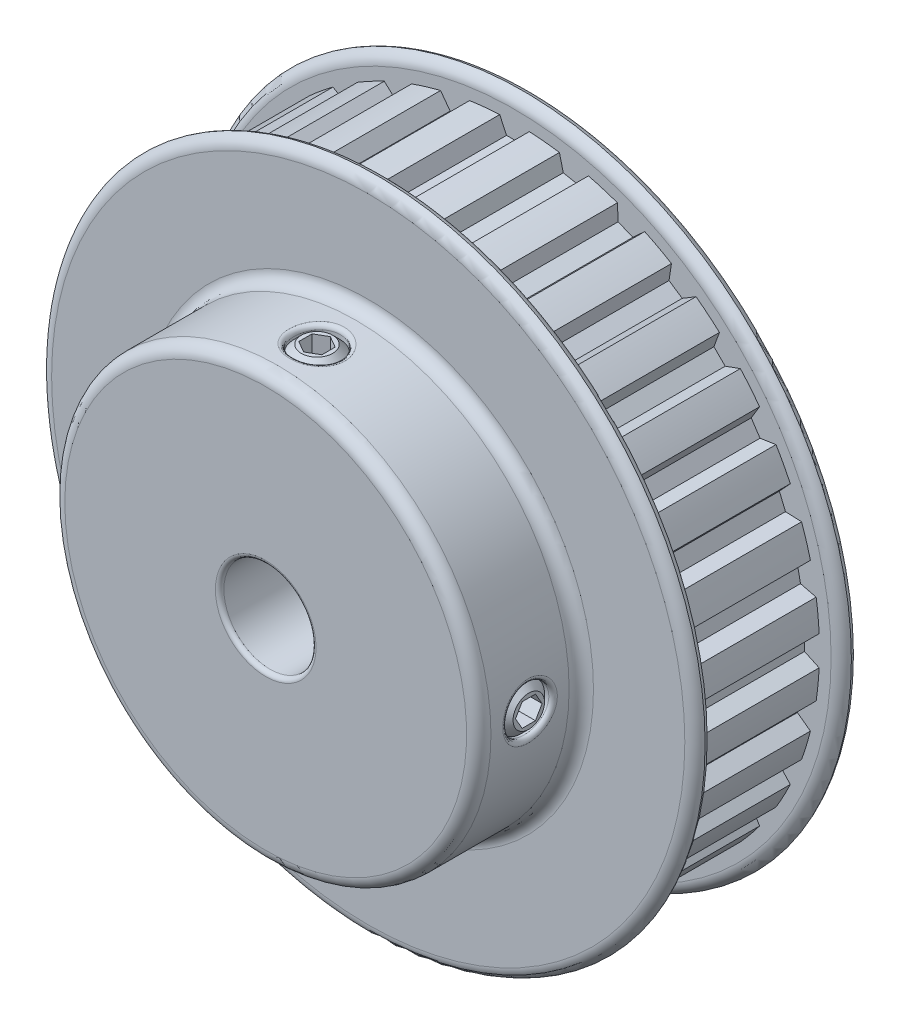
from build123d import *

# Parameters (mm, degrees)
CUT_EXTRUDE1_START = -10.05
CUT_EXTRUDE1_DEPTH = 11.2
CIRPATTERN1_COUNT  = 32
SKETCH4_R          = 2
CUT_EXTRUDE2_DEPTH = 42.927347877
CUT_EXTRUDE3_DEPTH = 1.5
CIRPATTERN2_COUNT  = 2
CIRPATTERN2_ANGLE  = 90
FILLET1_R          = 1.057142857
FILLET2_R          = 0.37


with BuildPart() as part:
    # Sketch7 → Revolve1 (revolve)
    with BuildSketch(Plane(origin=(0, 0, 0), x_dir=(0, 0, -1), z_dir=(1, 0, 0)), mode=Mode.PRIVATE) as revolve1_sk:
        with BuildLine():
            Line((-11.55, 4), (-11.55, 18.5))
            Line((-11.55, 18.5), (-2.65, 18.5))
            Line((-2.65, 18.5), (-2.65, 28.5))
            Line((-2.65, 28.5), (-1.9, 28.5))
            ThreePointArc((-1.9, 28.5), (-1.358015269, 28.119219543), (-1.15, 27.49035481))
            Line((-1.15, 27.49035481), (-1.15, 26.480709619))
            Line((-1.15, 26.480709619), (10.05, 26.480709619))
            Line((10.05, 26.480709619), (10.05, 27.49035481))
            ThreePointArc((10.05, 27.49035481), (10.258015269, 28.119219543), (10.8, 28.5))
            Line((10.8, 28.5), (11.55, 28.5))
            Line((11.55, 28.5), (11.55, 4))
            Line((11.55, 4), (-11.55, 4))
        make_face()
    revolve(revolve1_sk.sketch.rotate(Axis((0, 0, 11.55), (0, 0, -1)), 90), axis=Axis((0, 0, 11.55), (0, 0, -1)))

    # Sketch3 → Cut-Extrude1 (cut)
    with BuildSketch(Plane.XY.offset(CUT_EXTRUDE1_START)):
        with BuildLine():
            Line((-0.690489274, 25.179625), (0.690489274, 25.179625))
            Line((0.690489274, 25.179625), (1.2827, 26.449625))
            ThreePointArc((1.2827, 26.449625), (0, 26.480709619), (-1.2827, 26.449625))
            Line((-1.2827, 26.449625), (-0.690489274, 25.179625))
        make_face()
    cut_extrude1 = extrude(amount=CUT_EXTRUDE1_DEPTH, mode=Mode.SUBTRACT)

    # CirPattern1: Cut-Extrude1 ×32 about axis
    cirpattern1_axis = Axis((0, 0, 0), (0, 0, 1))
    for i in range(1, CIRPATTERN1_COUNT):
        add(cut_extrude1.rotate(cirpattern1_axis, i * 360 / CIRPATTERN1_COUNT), mode=Mode.SUBTRACT)

    # Sketch4 → Cut-Extrude2 (cut, through all)
    with BuildSketch(Plane(origin=(0, 0, 0), x_dir=(1, 0, 0), z_dir=(0, 1, 0))):
        with Locations(Location((0, -7.1, 0), (0, 0, 90))):
            Circle(SKETCH4_R)
    cut_extrude2 = extrude(amount=CUT_EXTRUDE2_DEPTH, mode=Mode.SUBTRACT)

    # Sketch5 → Revolve2 (revolve)
    with BuildSketch(Plane.XY.offset(7.1), mode=Mode.PRIVATE) as revolve2_sk:
        Polygon((0, 18.391574158), (0, 4), (-1.365, 4), (-2, 4.635), (-2, 17.756574158), (-1.365, 18.391574158), align=None)
    revolve2 = revolve(revolve2_sk.sketch.rotate(Axis((0, 0, 7.1), (0, 1, 0)), 270), axis=Axis((0, 0, 7.1), (0, 1, 0)))

    # Sketch6 → Cut-Extrude3 (cut)
    with BuildSketch(Plane(origin=(0, 18.391574158, 0), x_dir=(-1, 0, 0), z_dir=(0, -1, 0))):
        Polygon((0, -5.945299462), (-1, -6.522649731), (-1, -7.677350269), (0, -8.254700538), (1, -7.677350269), (1, -6.522649731), align=None)
    cut_extrude3 = extrude(amount=CUT_EXTRUDE3_DEPTH, mode=Mode.SUBTRACT)

    # CirPattern2: Cut-Extrude2, Revolve2, Cut-Extrude3 ×2 about axis
    cirpattern2_axis = Axis((0, 0, 0), (0, 0, -1))
    add([cut_extrude2.rotate(cirpattern2_axis, i * CIRPATTERN2_ANGLE / (CIRPATTERN2_COUNT - 1)) for i in range(1, CIRPATTERN2_COUNT)], mode=Mode.SUBTRACT)
    add([revolve2.rotate(cirpattern2_axis, i * CIRPATTERN2_ANGLE / (CIRPATTERN2_COUNT - 1)) for i in range(1, CIRPATTERN2_COUNT)])
    add([cut_extrude3.rotate(cirpattern2_axis, i * CIRPATTERN2_ANGLE / (CIRPATTERN2_COUNT - 1)) for i in range(1, CIRPATTERN2_COUNT)], mode=Mode.SUBTRACT)

    # Fillet1
    # the kernel refuses this fillet: 1.057142857 mm, written as the material it adds along each edge
    with BuildSketch(Plane(origin=(0, 0, 2.65), x_dir=(1, 0, 0), z_dir=(0, 1, 0))) as fillet1_piece_1:
        with BuildLine():
            CenterArc((18.5 + FILLET1_R, -FILLET1_R), FILLET1_R, 90, 90)
            Line((18.5 + FILLET1_R, 0), (18.5, 0))
            Line((18.5, 0), (18.5, -FILLET1_R))
        make_face()
    revolve(axis=Axis((0, 0, 2.65), (0, 0, -1)))
    # the kernel refuses this fillet: 1.057142857 mm, written as the material it takes off along each edge
    with BuildSketch(Plane(origin=(0, 0, -11.55), x_dir=(1, 0, 0), z_dir=(0, 1, 0))) as fillet1_2_piece_1:
        with BuildLine():
            CenterArc((27.488459449, -1.057142857), FILLET1_R, 16.890320162, 73.109679838)
            Line((28.5, -0.75), (28.5, 0))
            Line((28.5, 0), (27.488459449, 0))
        make_face()
    revolve(axis=Axis((0, 0, -11.55), (0, 0, -1)), mode=Mode.SUBTRACT)
    with BuildSketch(Plane(origin=(0, 0, 11.55), x_dir=(1, 0, 0), z_dir=(0, 1, 0))) as fillet1_2_piece_2:
        with BuildLine():
            CenterArc((18.5 - FILLET1_R, FILLET1_R), FILLET1_R, 270, 90)
            Line((18.5, FILLET1_R), (18.5, 0))
            Line((18.5, 0), (18.5 - FILLET1_R, 0))
        make_face()
    revolve(axis=Axis((0, 0, 11.55), (0, 0, -1)), mode=Mode.SUBTRACT)
    with BuildSketch(Plane(origin=(0, 0, 2.65), x_dir=(1, 0, 0), z_dir=(0, 1, 0))) as fillet1_2_piece_3:
        with BuildLine():
            CenterArc((27.488459449, 1.057142857), FILLET1_R, 270, 73.109679838)
            Line((28.5, 0.75), (28.5, 0))
            Line((28.5, 0), (27.488459449, 0))
        make_face()
    revolve(axis=Axis((0, 0, 2.65), (0, 0, -1)), mode=Mode.SUBTRACT)

    # Fillet2
    fillet2_edges = [part.edges().sort_by_distance(p)[0] for p in [
        (-4, 0, -11.55),
        (0, 18.500000001, 9.10000001),
        (18.391574158, -2, 7.1),
        (-4, 0, 11.55),
    ]]
    fillet(fillet2_edges, radius=FILLET2_R)


solid = part.part
